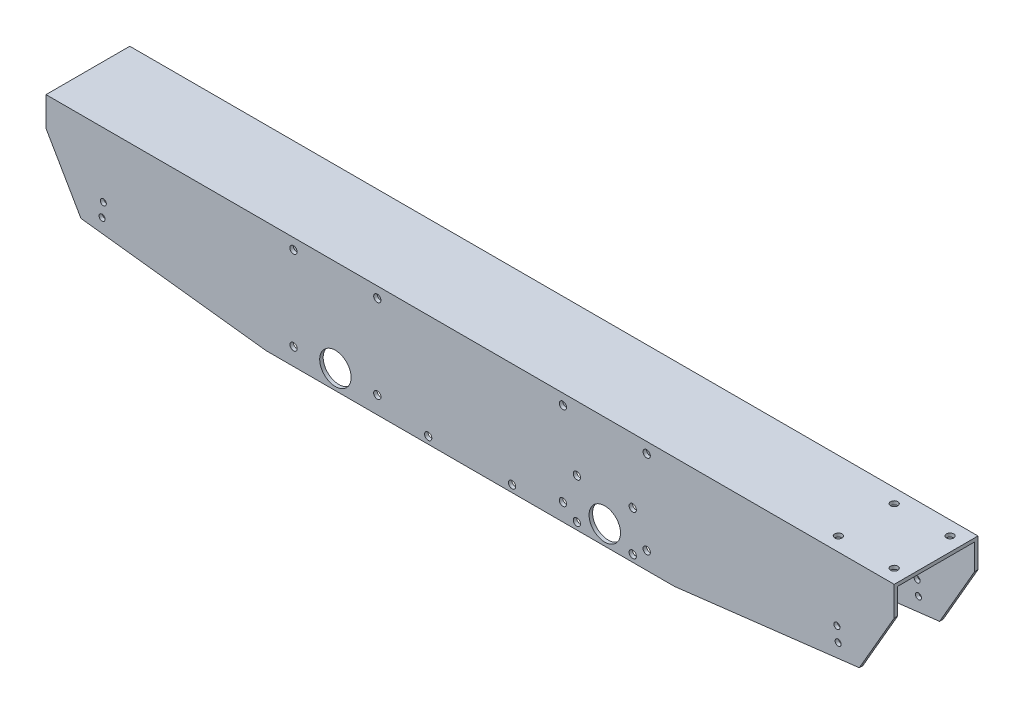
from build123d import *

# Parameters (mm, degrees)
BOSS_EXTRUDE1_DEPTH                     = 385.705756272
SKETCH2_R                               = 2.749999961
SKETCH2_R_2                             = 2.75
SKETCH2_R_3                             = 3.302
SKETCH2_R_4                             = 14.2875
AXLES_DEPTH                             = 141.732
FLANIGAN_MOUNTING_HOLES_R               = 3.3
FLANIGAN_MOUNTING_HOLES_EXTRUSION_DEPTH = 397.429073633
BEVELED_ENDS_DEPTH                      = 101.6
SKETCH32_R                              = 3.3
CUT_EXTRUDE27_DEPTH                     = 397.429073633
SKETCH33_R                              = 3.3
CUT_EXTRUDE22_DEPTH                     = 397.429073633
SKETCH37_R                              = 3.3
CUT_EXTRUDE26_DEPTH                     = 401.678300412


with BuildPart() as part:
    # Sketch1 → Boss-Extrude1 (new, symmetric)
    with BuildSketch(Plane(origin=(0, 0, 0), x_dir=(0, 0, -1), z_dir=(1, 0, 0))):
        Polygon((-38.1, 50.8), (38.1, 50.8), (38.1, -50.8), (34.925, -50.8), (34.925, 47.625), (-34.925, 47.625), (-34.925, -50.8), (-38.1, -50.8), align=None)
    extrude(amount=BOSS_EXTRUDE1_DEPTH, both=True)

    # Sketch2 → Axles (cut)
    with BuildSketch(Plane.XY.offset(38.1)):
        with Locations((-333.577237048, -7.874)):
            Circle(SKETCH2_R)
        with Locations((334.720333616, -20.574)):
            Circle(SKETCH2_R_2)
        with Locations((333.577237048, -7.874)):
            Circle(SKETCH2_R)
        with Locations((160.6, 41.08)):
            Circle(SKETCH2_R_3)
        with Locations((-160.6, -35.12)):
            Circle(SKETCH2_R_3)
        with Locations((-160.6, 41.08)):
            Circle(SKETCH2_R_3)
        with Locations((-122.5, -33.274)):
            Circle(SKETCH2_R_4)
        with Locations((-334.720333616, -20.574)):
            Circle(SKETCH2_R_2)
        with Locations((-84.4, 41.08)):
            Circle(SKETCH2_R_3)
        with Locations((-84.4, -35.12)):
            Circle(SKETCH2_R_3)
        with Locations((84.4, 41.08)):
            Circle(SKETCH2_R_3)
        with Locations((84.4, -35.12)):
            Circle(SKETCH2_R_3)
        with Locations((160.6, -35.12)):
            Circle(SKETCH2_R_3)
        with Locations((122.5, -33.274)):
            Circle(SKETCH2_R_4)
    extrude(amount=-AXLES_DEPTH, mode=Mode.SUBTRACT)

    # Flanigan mounting holes → Flanigan mounting holes extrusion (cut, through all)
    with BuildSketch(Plane.XY.offset(38.1)):
        with Locations((97.1, -7.87)):
            Circle(FLANIGAN_MOUNTING_HOLES_R)
        with Locations((97.1, -44.45)):
            Circle(FLANIGAN_MOUNTING_HOLES_R)
        with Locations((147.9, -7.87)):
            Circle(FLANIGAN_MOUNTING_HOLES_R)
        with Locations((147.9, -44.45)):
            Circle(FLANIGAN_MOUNTING_HOLES_R)
    extrude(amount=-FLANIGAN_MOUNTING_HOLES_EXTRUSION_DEPTH, mode=Mode.SUBTRACT)

    # Sketch16 → Beveled ends (cut)
    with BuildSketch(Plane.XY.offset(38.1)):
        Polygon((-353.951491467, -30.8), (-185.705756272, -50.8), (-385.705756272, -50.8), (-385.705756272, 24.2), align=None)
        Polygon((385.705756272, -50.8), (185.705756272, -50.8), (353.951491467, -30.8), (385.705756272, 24.2), align=None)
    extrude(amount=-BEVELED_ENDS_DEPTH, mode=Mode.SUBTRACT)

    # Sketch32 → Cut-Extrude27 (cut, through all)
    with BuildSketch(Plane(origin=(0, 0, -38.1), x_dir=(-1, 0, 0), z_dir=(0, 0, -1))):
        with Locations((-38.1, -44.45)):
            Circle(SKETCH32_R)
    extrude(amount=-CUT_EXTRUDE27_DEPTH, mode=Mode.SUBTRACT)

    # Sketch33 → Cut-Extrude22 (cut, through all)
    with BuildSketch(Plane(origin=(0, 0, -38.1), x_dir=(-1, 0, 0), z_dir=(0, 0, -1))):
        with Locations((38.1, -44.45)):
            Circle(SKETCH33_R)
    extrude(amount=-CUT_EXTRUDE22_DEPTH, mode=Mode.SUBTRACT)

    # Sketch37 → Cut-Extrude26 (cut, through all)
    with BuildSketch(Plane(origin=(0, 50.8, 0), x_dir=(1, 0, 0), z_dir=(0, 1, 0))):
        with Locations((373.005756272, 25.4)):
            Circle(SKETCH37_R)
        with Locations((373.005756272, -25.4)):
            Circle(SKETCH37_R)
        with Locations((322.205756272, 25.4)):
            Circle(SKETCH37_R)
        with Locations((322.205756272, -25.4)):
            Circle(SKETCH37_R)
    extrude(amount=-CUT_EXTRUDE26_DEPTH, mode=Mode.SUBTRACT)


solid = part.part
